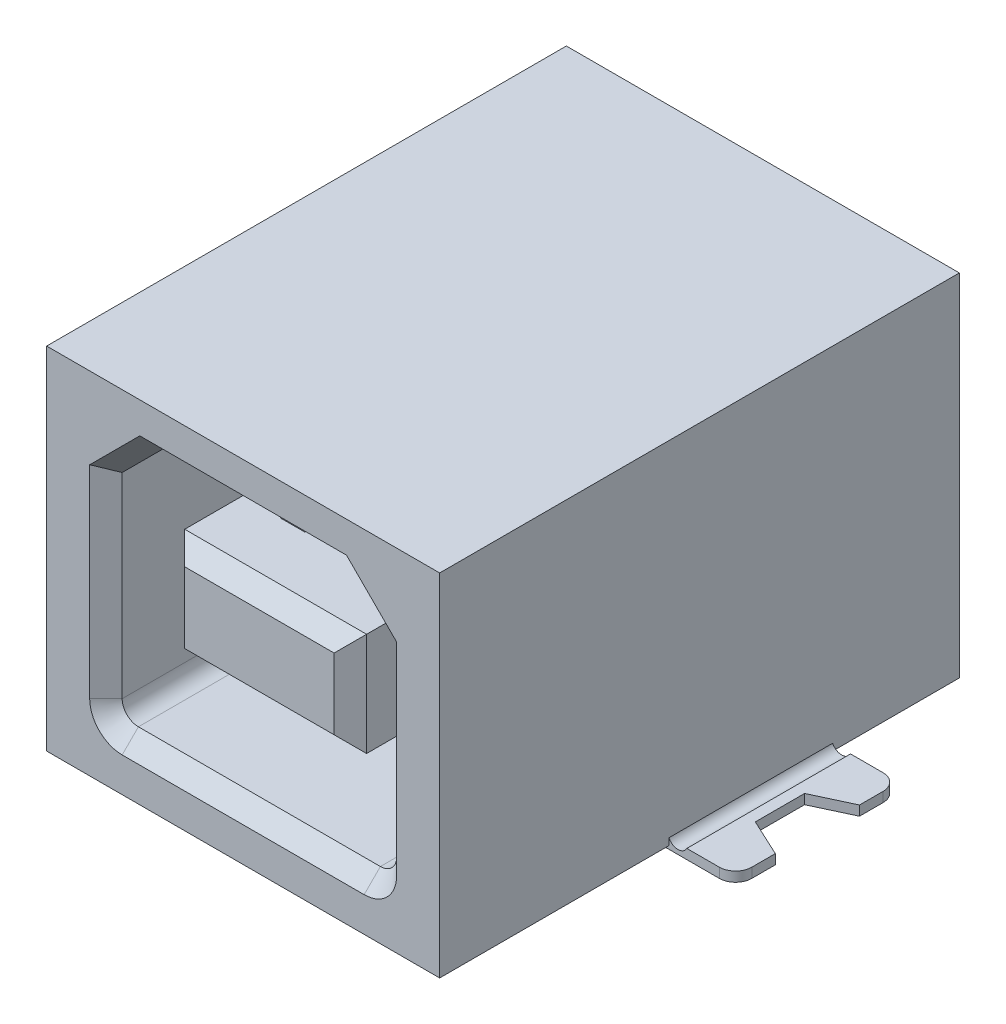
from build123d import *

# Parameters (mm, degrees)
SKETCH1_W                    = 12.1
SKETCH1_H                    = 10.8
BASE_DEPTH                   = 8
CONTACT_OPENING_DEPTH        = 9
CONTACT_OPENING_LEAD_IN_SIZE = 0.5
SKETCH3_W                    = 5.6
SKETCH3_H                    = 3.18
CONTACT_AREA_DEPTH           = 8.5
CONTACT_AREA_LEAD_IN_SIZE    = 0.5
GROUND_LEGS_DEPTH            = 2.52
GROUND_LEGS_SHAPE_DEPTH      = 0.3
SM_TAILS_DEPTH               = 0.3
CONTACT_DEPTH                = 0.375
CONTACT_PATTERN_COUNT        = 2
CONTACT_PATTERN_PITCH        = 2.5
LPATTERN1_COUNT              = 2
LPATTERN1_PITCH              = 1.25
LPATTERN1_COUNT_DIR2         = 3
LPATTERN1_PITCH_DIR2         = 1.25
SKETCH12_R                   = 0.575
ALIGNMENT_PIN_DEPTH          = 1.9
PIN_POINT_SIZE               = 0.05


with BuildPart() as part:
    # Sketch1 → Base (new, symmetric)
    with BuildSketch(Plane.XY):
        Rectangle(SKETCH1_W, SKETCH1_H)
    extrude(amount=BASE_DEPTH, both=True)

    # Sketch2 → Contact Opening (cut)
    with BuildSketch(Plane.XY.offset(8)):
        with BuildLine():
            Line((-2.975, 3.94), (-4.225, 2.69))
            Line((-4.225, 2.69), (-4.225, -3.34))
            ThreePointArc((-4.225, -3.34), (-4.078553391, -3.693553391), (-3.725, -3.84))
            Line((-3.725, -3.84), (3.725, -3.84))
            ThreePointArc((3.725, -3.84), (4.078553391, -3.693553391), (4.225, -3.34))
            Line((4.225, -3.34), (4.225, 2.69))
            Line((4.225, 2.69), (2.975, 3.94))
            Line((2.975, 3.94), (-2.975, 3.94))
        make_face()
    extrude(amount=-CONTACT_OPENING_DEPTH, mode=Mode.SUBTRACT)

    # Contact Opening Lead-in
    contact_opening_lead_in_edges = [part.edges().sort_by_distance(p)[0] for p in [
        (-3.6, 3.315, 8),
        (0, 3.94, 8),
        (3.6, 3.315, 8),
        (4.225, -0.325, 8),
        (4.078553391, -3.693553391, 8),
        (0, -3.84, 8),
        (-4.078553391, -3.693553391, 8),
        (-4.225, -0.325, 8),
    ]]
    chamfer(contact_opening_lead_in_edges, length=CONTACT_OPENING_LEAD_IN_SIZE)

    # Sketch3 → Contact Area (add)
    with BuildSketch(Plane.XY.offset(-1)):
        with Locations((0, 0.05)):
            Rectangle(SKETCH3_W, SKETCH3_H)
    extrude(amount=CONTACT_AREA_DEPTH)

    # Contact Area Lead-in
    contact_area_lead_in_edges = [part.edges().sort_by_distance(p)[0] for p in [
        (0, 1.64, 7.5),
        (2.8, 0.05, 7.5),
        (0, -1.54, 7.5),
        (-2.8, 0.05, 7.5),
    ]]
    chamfer(contact_area_lead_in_edges, length=CONTACT_AREA_LEAD_IN_SIZE)

    # Sketch4 → Ground Legs (add, symmetric)
    with BuildSketch(Plane.XY.offset(-1.58)):
        with BuildLine():
            Line((6.02, -5.058034034), (5.72, -5.100661668))
            ThreePointArc((5.72, -5.100661668), (5.776842077, -5.318050295), (5.90868722, -5.5))
            Line((5.90868722, -5.5), (8.1, -5.5))
            Line((8.1, -5.5), (8.1, -5.2))
            Line((8.1, -5.2), (6.599504335, -5.2))
            ThreePointArc((6.599504335, -5.2), (6.254059507, -5.356354169), (6.02, -5.058034034))
        make_face()
        with BuildLine():
            Line((-5.90868722, -5.5), (-8.1, -5.5))
            Line((-8.1, -5.5), (-8.1, -5.2))
            Line((-8.1, -5.2), (-6.599504335, -5.2))
            ThreePointArc((-6.599504335, -5.2), (-6.254059507, -5.356354169), (-6.02, -5.058034034))
            Line((-6.02, -5.058034034), (-5.72, -5.100661668))
            ThreePointArc((-5.72, -5.100661668), (-5.776842077, -5.318050295), (-5.90868722, -5.5))
        make_face()
    extrude(amount=GROUND_LEGS_DEPTH, both=True)

    # Sketch9 → ground legs shape (cut)
    with BuildSketch(Plane(origin=(0, -5.2, 0), x_dir=(-1, 0, 0), z_dir=(0, 1, 0))):
        with BuildLine():
            Line((-8.1, -4.1), (-8.1, -3.6))
            ThreePointArc((-8.1, -3.6), (-7.953553391, -3.953553391), (-7.6, -4.1))
            Line((-7.6, -4.1), (-8.1, -4.1))
        make_face()
        Polygon((-8.1, -2.875946044), (-6.946732983, -2.33830257), (-6.946732983, -0.82169743), (-8.1, -0.284053956), align=None)
        with BuildLine():
            Line((-8.1, 0.94), (-7.6, 0.94))
            ThreePointArc((-7.6, 0.94), (-7.953553391, 0.793553391), (-8.1, 0.44))
            Line((-8.1, 0.44), (-8.1, 0.94))
        make_face()
        with BuildLine():
            Line((8.1, 0.94), (8.1, 0.44))
            ThreePointArc((8.1, 0.44), (7.953553391, 0.793553391), (7.6, 0.94))
            Line((7.6, 0.94), (8.1, 0.94))
        make_face()
        Polygon((8.1, -0.284053956), (6.946732983, -0.82169743), (6.946732983, -2.33830257), (8.1, -2.875946044), align=None)
        with BuildLine():
            Line((8.1, -4.1), (7.6, -4.1))
            ThreePointArc((7.6, -4.1), (7.953553391, -3.953553391), (8.1, -3.6))
            Line((8.1, -3.6), (8.1, -4.1))
        make_face()
    extrude(amount=-GROUND_LEGS_SHAPE_DEPTH, mode=Mode.SUBTRACT)

    # Sketch11 → SM Tails (add, symmetric)
    with BuildSketch(Plane(origin=(0.75, 0, 0), x_dir=(0, 0, -1), z_dir=(1, 0, 0))):
        with BuildLine():
            Line((7.15, -5.3), (7.15, -5.15))
            Line((7.15, -5.15), (7.4, -5.15))
            ThreePointArc((7.4, -5.15), (7.429289322, -5.220710678), (7.5, -5.25))
            Line((7.5, -5.25), (9.15, -5.25))
            Line((9.15, -5.25), (9.15, -5.5))
            Line((9.15, -5.5), (7.35, -5.5))
            ThreePointArc((7.35, -5.5), (7.208578644, -5.441421356), (7.15, -5.3))
        make_face()
    sm_tails = extrude(amount=SM_TAILS_DEPTH, both=True)

    # Sketch8 → Contact (add, symmetric)
    with BuildSketch(Plane(origin=(-1.25, 0, 0), x_dir=(0, 0, -1), z_dir=(1, 0, 0))):
        with BuildLine():
            Line((1, 1.64), (-2.511141434, 2.21990157))
            ThreePointArc((-2.511141434, 2.21990157), (-3.280012008, 2.246903627), (-4.030467404, 2.077469952))
            Line((-4.030467404, 2.077469952), (-5.5, 1.54))
            Line((-5.5, 1.54), (-5.439889401, 1.375647586))
            Line((-5.439889401, 1.375647586), (-3.970356805, 1.913117538))
            ThreePointArc((-3.970356805, 1.913117538), (-3.263677974, 2.072667582), (-2.539658184, 2.047240645))
            Line((-2.539658184, 2.047240645), (0.97148325, 1.467339075))
            Line((0.97148325, 1.467339075), (1, 1.64))
        make_face()
        with BuildLine():
            Line((-5.439889401, -1.275647586), (-5.5, -1.44))
            Line((-5.5, -1.44), (-4.030467404, -1.977469952))
            ThreePointArc((-4.030467404, -1.977469952), (-3.280012008, -2.146903627), (-2.511141434, -2.11990157))
            Line((-2.511141434, -2.11990157), (1, -1.54))
            Line((1, -1.54), (0.97148325, -1.367339075))
            Line((0.97148325, -1.367339075), (-2.539658184, -1.947240645))
            ThreePointArc((-2.539658184, -1.947240645), (-3.263677974, -1.972667582), (-3.970356805, -1.813117538))
            Line((-3.970356805, -1.813117538), (-5.439889401, -1.275647586))
        make_face()
    contact = extrude(amount=CONTACT_DEPTH, both=True)

    # Contact Pattern: Contact ×2
    with Locations(*[(i * CONTACT_PATTERN_PITCH, 0, 0) for i in range(1, CONTACT_PATTERN_COUNT)]):
        add(contact)

    # LPattern1: SM Tails 2 × 3
    with Locations(*[Vector(1, 0, 0) * (i * LPATTERN1_PITCH) + Vector(-1, 0, 0) * (j * LPATTERN1_PITCH_DIR2) for i in range(LPATTERN1_COUNT) for j in range(LPATTERN1_COUNT_DIR2) if (i, j) != (0, 0)]):
        add(sm_tails)

    # Sketch12 → Alignment Pin (add)
    with BuildSketch(Plane.XZ.offset(5.4)):
        with Locations((2.75, -1)):
            Circle(SKETCH12_R)
        with Locations((-2.75, -1)):
            Circle(SKETCH12_R)
    extrude(amount=ALIGNMENT_PIN_DEPTH)

    # Pin Point
    pin_point_edges = [part.edges().sort_by_distance(p)[0] for p in [
        (2.175, -7.3, -1),
        (-3.325, -7.3, -1),
    ]]
    chamfer(pin_point_edges, length=PIN_POINT_SIZE)


solid = part.part
